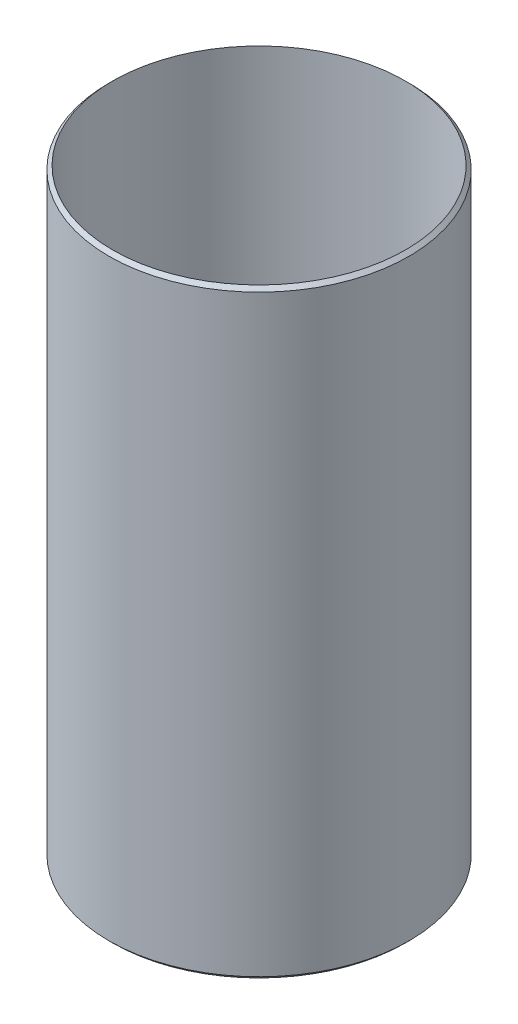
from build123d import *

# Parameters (mm, degrees)
SKETCH1_R           = 82.55
SKETCH1_R_2         = 76.55
BOSS_EXTRUDE1_DEPTH = 330.2
CHAMFER1_SIZE       = 2
SKETCH2_R           = 80.55
CUT_EXTRUDE1_DEPTH  = 165.1
CUT_EXTRUDE2_START  = -117.95
SKETCH3_R           = 80.55
CUT_EXTRUDE2_DEPTH  = 117.95


with BuildPart() as part:
    # Sketch1 → Boss-Extrude1 (new body)
    with BuildSketch(Plane(origin=(0, 0, 0), x_dir=(1, 0, 0), z_dir=(0, 1, 0))):
        Circle(SKETCH1_R)
        Circle(SKETCH1_R_2, mode=Mode.SUBTRACT)
    extrude(amount=BOSS_EXTRUDE1_DEPTH)

    # Chamfer1
    chamfer1_edges = [part.edges().sort_by_distance(p)[0] for p in [
        (-82.55, 0, 0),
        (-82.55, 330.2, 0),
    ]]
    chamfer(chamfer1_edges, length=CHAMFER1_SIZE)

    # Sketch2 → Cut-Extrude1 (cut)
    with BuildSketch(Plane.XZ):
        Circle(SKETCH2_R)
    extrude(amount=-CUT_EXTRUDE1_DEPTH, mode=Mode.SUBTRACT)

    # Sketch3 → Cut-Extrude2 (cut)
    with BuildSketch(Plane(origin=(0, 330.2, 0), x_dir=(1, 0, 0), z_dir=(0, 1, 0)).offset(CUT_EXTRUDE2_START)):
        Circle(SKETCH3_R)
    extrude(amount=CUT_EXTRUDE2_DEPTH, mode=Mode.SUBTRACT)


solid = part.part
